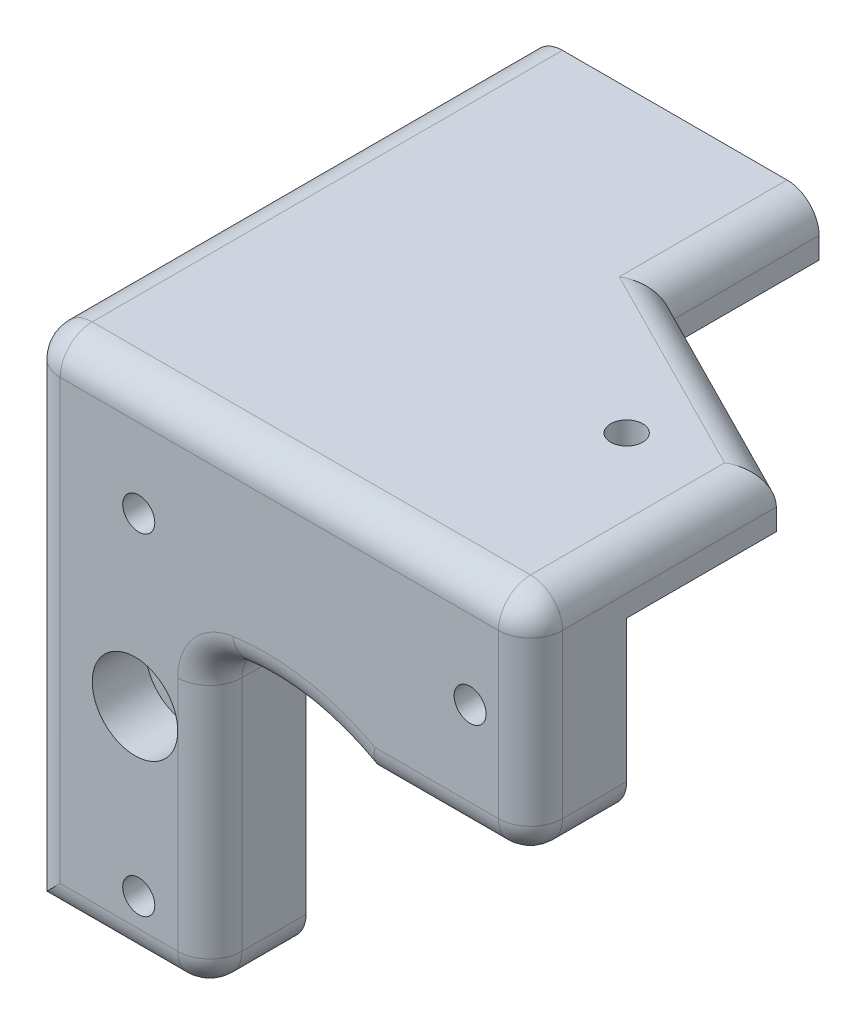
from build123d import *

# Parameters (mm, degrees)
BOSS_EXTRUDE1_DEPTH = 9
SKETCH3_R           = 1.5
CUT_EXTRUDE1_DEPTH  = 10
SKETCH8_W           = 5
SKETCH8_H           = 47
BOSS_EXTRUDE2_DEPTH = 38
SKETCH9_W           = 42
SKETCH9_H           = 5
BOSS_EXTRUDE3_DEPTH = 38
CUT_EXTRUDE2_DEPTH  = 38
SKETCH11_R          = 4
CUT_EXTRUDE3_DEPTH  = 5
CUT_EXTRUDE4_DEPTH  = 10
SKETCH13_R          = 1.5
CUT_EXTRUDE5_DEPTH  = 74.600271739
SKETCH14_R          = 3
CUT_EXTRUDE6_DEPTH  = 2
FILLET1_R           = 3


with BuildPart() as part:
    # Sketch2 → Boss-Extrude1 (new body)
    with BuildSketch(Plane.XY):
        with BuildLine():
            Line((0, 0), (0, 47))
            Line((0, 47), (47, 47))
            Line((47, 47), (47, 25.75))
            Line((47, 25.75), (31.68, 25.75))
            ThreePointArc((31.68, 25.75), (24.5283031, 28.175540714), (17, 27.58))
            Line((17, 27.58), (17, 0))
            Line((17, 0), (0, 0))
        make_face()
    extrude(amount=BOSS_EXTRUDE1_DEPTH)

    # Sketch3 → Cut-Extrude1 (cut)
    with BuildSketch(Plane.XY.offset(9)):
        with Locations((10.35, 5.65)):
            Circle(SKETCH3_R)
        with Locations((10.35, 36.65)):
            Circle(SKETCH3_R)
        with Locations((41.35, 36.65)):
            Circle(SKETCH3_R)
    extrude(amount=-CUT_EXTRUDE1_DEPTH, mode=Mode.SUBTRACT)

    # Sketch8 → Boss-Extrude2 (add)
    with BuildSketch(Plane(origin=(0, 0, 0), x_dir=(-1, 0, 0), z_dir=(0, 0, -1))):
        with Locations((-2.5, 23.5)):
            Rectangle(SKETCH8_W, SKETCH8_H)
    extrude(amount=BOSS_EXTRUDE2_DEPTH)

    # Sketch9 → Boss-Extrude3 (add)
    with BuildSketch(Plane(origin=(0, 0, 0), x_dir=(-1, 0, 0), z_dir=(0, 0, -1))):
        with Locations((-26, 44.5)):
            Rectangle(SKETCH9_W, SKETCH9_H)
    extrude(amount=BOSS_EXTRUDE3_DEPTH)

    # Sketch10 → Cut-Extrude2 (cut)
    with BuildSketch(Plane.ZY):
        Polygon((0, 0), (-23, 32), (-38, 32), (-38, 0), align=None)
    extrude(amount=-CUT_EXTRUDE2_DEPTH, mode=Mode.SUBTRACT)

    # Sketch11 → Cut-Extrude3 (cut)
    with BuildSketch(Plane.XY.offset(9)):
        with Locations((10, 20.85)):
            Circle(SKETCH11_R)
    extrude(amount=-CUT_EXTRUDE3_DEPTH, mode=Mode.SUBTRACT)

    # Sketch12 → Cut-Extrude4 (cut)
    with BuildSketch(Plane.XZ.offset(-42)):
        Polygon((47, -38), (47, -14), (27, -24.148784343), (27, -38), align=None)
    extrude(amount=-CUT_EXTRUDE4_DEPTH, mode=Mode.SUBTRACT)

    # Sketch13 → Cut-Extrude5 (cut, through all)
    with BuildSketch(Plane.XZ.offset(-42)):
        with Locations((37, -10)):
            Circle(SKETCH13_R)
    extrude(amount=-CUT_EXTRUDE5_DEPTH, mode=Mode.SUBTRACT)

    # Sketch14 → Cut-Extrude6 (cut)
    with BuildSketch(Plane(origin=(0, 42, 0), x_dir=(-1, 0, 0), z_dir=(0, -1, 0))):
        with Locations(Location((-37, 10, 0), (0, 0, 180))):
            Circle(SKETCH14_R)
    extrude(amount=-CUT_EXTRUDE6_DEPTH, mode=Mode.SUBTRACT)

    # Fillet1
    fillet1_edges = [part.edges().sort_by_distance(p)[0] for p in [
        (24.5283031, 28.175540714, 9),
        (0, 47, -14.5),
        (47, 47, -2.5),
        (47, 25.75, 4.5),
        (17, 27.58, 4.5),
        (17, 0, 4.5),
        (39.34, 25.75, 9),
        (47, 36.375, 9),
        (23.5, 47, 9),
        (0, 23.5, 9),
        (8.5, 0, 9),
        (17, 13.79, 9),
        (0, 16, -11.5),
        (0, 32, -30.5),
        (27, 47, -31.074392172),
        (37, 47, -19.074392172),
    ]]
    fillet(fillet1_edges, radius=FILLET1_R - 0.0001)  # a hair under: the kernel refuses the full size


solid = part.part
